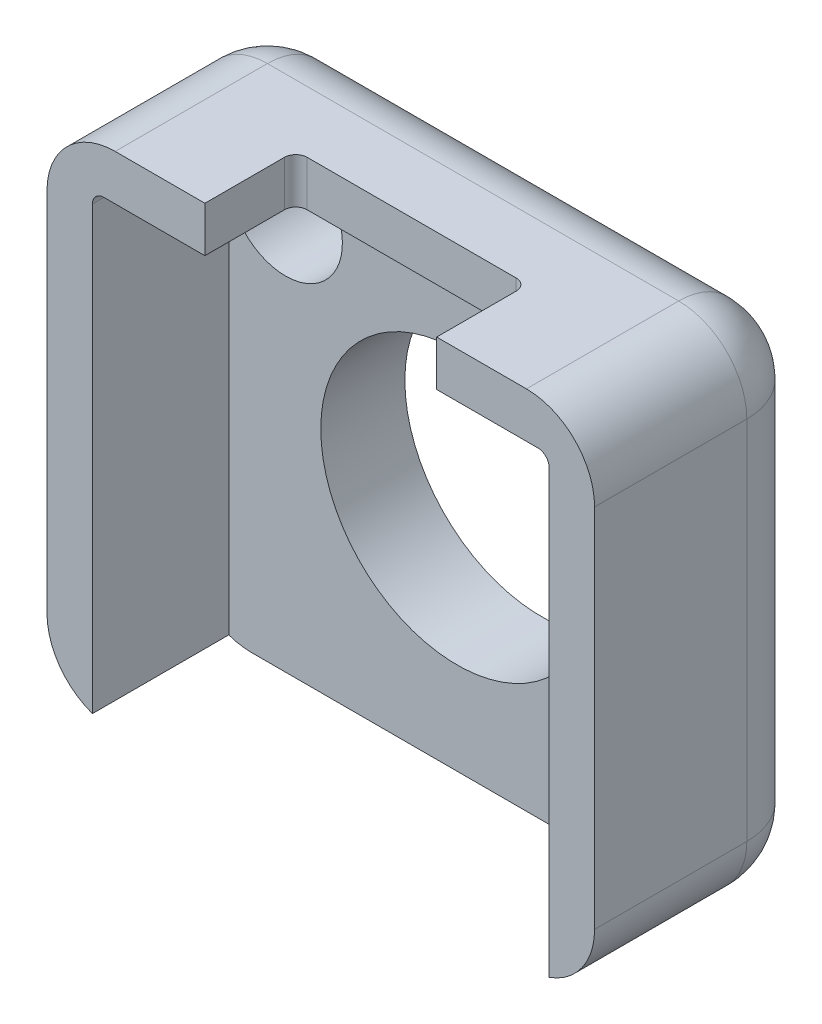
from build123d import *

# Parameters (mm, degrees)
SKETCH1_W               = 20.1
SKETCH1_H               = 20.1
BOSS_EXTRUDE2_DEPTH     = 3.7
BOSS_EXTRUDE3_DEPTH     = 9.7
FILLET1_R               = 3
SKETCH2_W               = 10.2
SKETCH2_H               = 2
CUT_EXTRUDE1_DEPTH      = 4
FILLET3_R               = 3
FILLET2_R               = 0.5
CUT_EXTRUDE2_DEPTH      = 43.682031257
CUT_EXTRUDE2_DEPTH_BACK = 43.682031257
SKETCH4_R               = 2.5
SKETCH4_R_2             = 6


with BuildPart() as part:
    # Sketch1 → Boss-Extrude2 (new body)
    with BuildSketch(Plane.XY):
        with Locations((-13.623786408, 21.515048544)):
            Rectangle(SKETCH1_W, SKETCH1_H)
    extrude(amount=BOSS_EXTRUDE2_DEPTH)

    # Sketch1<3> → Boss-Extrude3 (add)
    with BuildSketch(Plane.XY):
        Polygon((-3.573786408, 31.565048544), (-3.573786408, 11.465048544), (-1.573786408, 11.465048544), (-1.573786408, 33.565048544), (-25.673786408, 33.565048544), (-25.673786408, 11.465048544), (-23.673786408, 11.465048544), (-23.673786408, 31.565048544), align=None)
    extrude(amount=BOSS_EXTRUDE3_DEPTH)

    # Fillet1
    fillet1_edges = [part.edges().sort_by_distance(p)[0] for p in [
        (-25.673786408, 22.515048544, 0),
        (-13.623786408, 33.565048544, 0),
        (-1.573786408, 22.515048544, 0),
        (-13.623786408, 11.465048544, 0),
    ]]
    fillet(fillet1_edges, radius=FILLET1_R)

    # Sketch2 → Cut-Extrude1 (cut)
    with BuildSketch(Plane.XY.offset(9.7)):
        with Locations((-13.623786408, 32.565048544)):
            Rectangle(SKETCH2_W, SKETCH2_H)
    extrude(amount=-CUT_EXTRUDE1_DEPTH, mode=Mode.SUBTRACT)

    # Fillet3
    # the kernel refuses this fillet: 3 mm, written as the material it takes off along each edge
    with BuildSketch(Plane(origin=(-22.673786408, 14.465048544, 3), x_dir=(-1, 0, 0), z_dir=(0, -1, 0))) as fillet3_piece_1_section:
        Polygon((0, 0), (FILLET3_R, 0), (FILLET3_R, FILLET3_R), (0, FILLET3_R), align=None)
    fillet3_piece_1 = extrude(amount=FILLET3_R, mode=Mode.PRIVATE)
    fillet3_piece_1 = fillet3_piece_1 - Plane(origin=(-22.673786408, 14.465048544, 3), x_dir=(0.7071067811865475, 0, 0.7071067811865475), z_dir=(0, -1, 0)) * Sphere(FILLET3_R, mode=Mode.PRIVATE)
    add(fillet3_piece_1, mode=Mode.SUBTRACT)
    with BuildSketch(Plane(origin=(-4.573786408, 14.465048544, 3), x_dir=(1, 0, 0), z_dir=(0, -1, 0))) as fillet3_piece_2_section:
        Polygon((0, 0), (FILLET3_R, 0), (FILLET3_R, -FILLET3_R), (0, -FILLET3_R), align=None)
    fillet3_piece_2 = extrude(amount=FILLET3_R, mode=Mode.PRIVATE)
    fillet3_piece_2 = fillet3_piece_2 - Plane(origin=(-4.573786408, 14.465048544, 3), x_dir=(-0.7071067811865475, 0, 0.7071067811865475), z_dir=(0, -1, 0)) * Sphere(FILLET3_R, mode=Mode.PRIVATE)
    add(fillet3_piece_2, mode=Mode.SUBTRACT)
    with BuildSketch(Plane(origin=(-4.573786408, 30.565048544, 3), x_dir=(0, 1, 0), z_dir=(1, 0, 0))) as fillet3_piece_3_section:
        Polygon((0, 0), (FILLET3_R, 0), (FILLET3_R, -FILLET3_R), (0, -FILLET3_R), align=None)
    fillet3_piece_3 = extrude(amount=FILLET3_R, mode=Mode.PRIVATE)
    fillet3_piece_3 = fillet3_piece_3 - Plane(origin=(-4.573786408, 30.565048544, 3), x_dir=(0, -0.7071067811865475, 0.7071067811865475), z_dir=(1, 0, 0)) * Sphere(FILLET3_R, mode=Mode.PRIVATE)
    add(fillet3_piece_3, mode=Mode.SUBTRACT)
    with BuildSketch(Plane(origin=(-22.673786408, 30.565048544, 3), x_dir=(0, 1, 0), z_dir=(-1, 0, 0))) as fillet3_piece_4_section:
        Polygon((0, 0), (FILLET3_R, 0), (FILLET3_R, FILLET3_R), (0, FILLET3_R), align=None)
    fillet3_piece_4 = extrude(amount=FILLET3_R, mode=Mode.PRIVATE)
    fillet3_piece_4 = fillet3_piece_4 - Plane(origin=(-22.673786408, 30.565048544, 3), x_dir=(0, -0.7071067811865475, 0.7071067811865475), z_dir=(-1, 0, 0)) * Sphere(FILLET3_R, mode=Mode.PRIVATE)
    add(fillet3_piece_4, mode=Mode.SUBTRACT)
    with BuildSketch(Plane(origin=(-25.673786408, 11.465048544, 3), x_dir=(1, 0, 0), z_dir=(0, 0, 1)), Plane(origin=(-25.673786408, 33.565048544, 3), x_dir=(0, -1, 0), z_dir=(0, 0, 1))) as fillet3_piece_5:
        with BuildLine():
            CenterArc((FILLET3_R, FILLET3_R), FILLET3_R, 180, 90)
            Line((0, FILLET3_R), (0, 0))
            Line((0, 0), (FILLET3_R, 0))
        make_face()
    extrude(amount=14.2, mode=Mode.SUBTRACT)
    with BuildSketch(Plane(origin=(-1.573786408, 11.465048544, 3), x_dir=(-1, 0, 0), z_dir=(0, 0, 1)), Plane(origin=(-1.573786408, 33.565048544, 3), x_dir=(0, -1, 0), z_dir=(0, 0, 1))) as fillet3_piece_6:
        with BuildLine():
            CenterArc((FILLET3_R, -FILLET3_R), FILLET3_R, 90, 90)
            Line((0, -FILLET3_R), (0, 0))
            Line((0, 0), (FILLET3_R, 0))
        make_face()
    extrude(amount=14.2, mode=Mode.SUBTRACT)

    # Fillet2
    fillet2_edges = [part.edges().sort_by_distance(p)[0] for p in [
        (-3.573786408, 31.565048544, 6.7),
        (-23.673786408, 31.565048544, 6.7),
        (-18.723786408, 32.565048544, 5.7),
        (-8.523786408, 32.565048544, 5.7),
    ]]
    fillet(fillet2_edges, radius=FILLET2_R)

    # Sketch4 → Cut-Extrude2 (cut, two sides: drawn at the far end of the back side and taken through both)
    with BuildSketch(Plane.XY.offset(3.7).offset(-CUT_EXTRUDE2_DEPTH_BACK)):
        with Locations(Location((-21.173786408, 29.065048544, 0), (0, 0, 36.869897646))):
            Circle(SKETCH4_R)
        with Locations((-6.073786408, 29.065048544)):
            Circle(SKETCH4_R)
        with Locations((-13.623786408, 21.515048544)):
            Circle(SKETCH4_R_2)
    extrude(amount=CUT_EXTRUDE2_DEPTH + CUT_EXTRUDE2_DEPTH_BACK, mode=Mode.SUBTRACT)


solid = part.part
